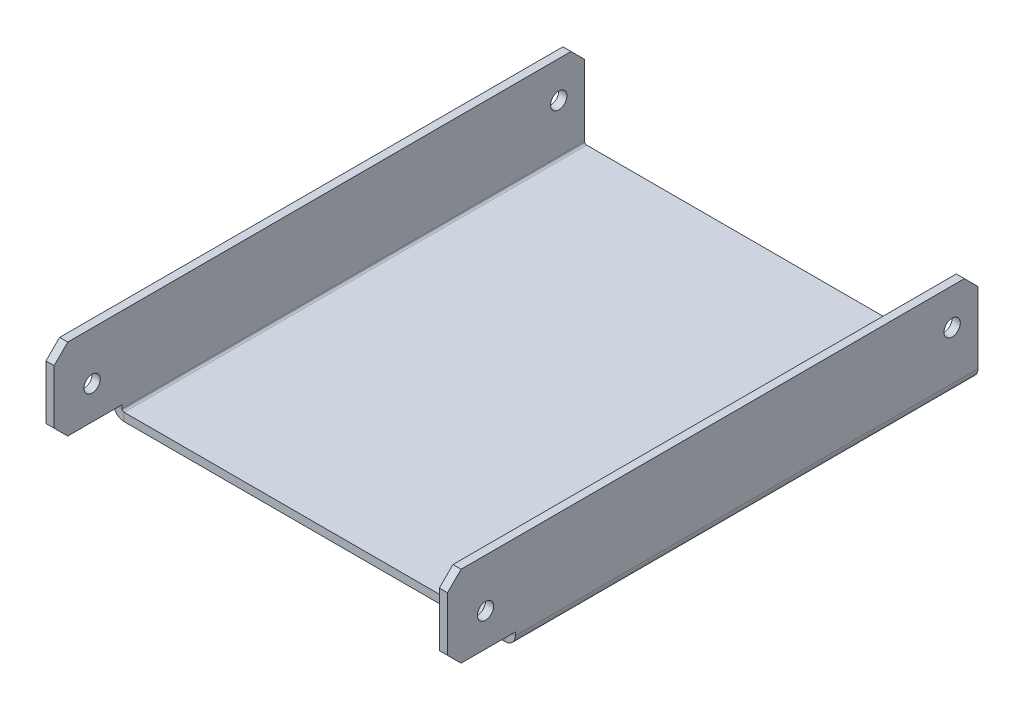
from build123d import *

# Parameters (mm, degrees)
SKETCH18_W                     = 148
SKETCH18_H                     = 205.5334
BASE_FLANGE1_DEPTH             = 3
EDGE_FLANGE1_STRIP_W           = 13.4732
EDGE_FLANGE1_STRIP_H           = 3
EDGE_FLANGE1_STRIP_CUT_DEPTH   = 205.5334
EDGE_FLANGE1_STRIP_2_W         = 13.4732
EDGE_FLANGE1_STRIP_2_H         = 3
EDGE_FLANGE1_STRIP_CUT_2_DEPTH = 205.5334
EDGE_FLANGE1_DEPTH             = 205.5334
EDGE_FLANGE1_BEND_DEPTH        = 205.5334
SKETCH28_W                     = 150
SKETCH28_H                     = 8
CUT_EXTRUDE2_DEPTH             = 25
SKETCH30_R                     = 3
CUT_EXTRUDE3_DEPTH             = 225.935458149
SKETCH31_W                     = 157.455262849
SKETCH31_H                     = 40
CUT_EXTRUDE4_DEPTH             = 10
CHAMFER1_SIZE                  = 5


# Sheet-metal steps are written as plain solids
with BuildPart() as part:
    # Sketch18 → Base-Flange1 (new body)
    with BuildSketch(Plane(origin=(0, 0, 0), x_dir=(1, 0, 0), z_dir=(0, 1, 0))):
        with Locations((-74, -63.57018807)):
            Rectangle(SKETCH18_W, SKETCH18_H)
    extrude(amount=-BASE_FLANGE1_DEPTH)

    # Edge-Flange1 strip (across the edge) → Edge-Flange1 strip cut (cut)
    with BuildSketch(Plane(origin=(0, 0, 166.33688807), x_dir=(-1, 0, 0), z_dir=(0, 0, -1))):
        with Locations((-3, -1.5)):
            Rectangle(EDGE_FLANGE1_STRIP_W, EDGE_FLANGE1_STRIP_H)
    extrude(amount=EDGE_FLANGE1_STRIP_CUT_DEPTH, mode=Mode.SUBTRACT)

    # Edge-Flange1 strip 2 (across the edge) → Edge-Flange1 strip cut 2 (cut)
    with BuildSketch(Plane(origin=(-148, 0, -39.19651193), x_dir=(1, 0, 0), z_dir=(0, 0, 1))):
        with Locations((-3, -1.5)):
            Rectangle(EDGE_FLANGE1_STRIP_2_W, EDGE_FLANGE1_STRIP_2_H)
    extrude(amount=EDGE_FLANGE1_STRIP_CUT_2_DEPTH, mode=Mode.SUBTRACT)

    # Edge-Flange1 section (across the edge) → Edge-Flange1 (add)
    with BuildSketch(Plane(origin=(0, 0, 166.33688807), x_dir=(-1, 0, 0), z_dir=(0, 0, -1))):
        with BuildLine():
            Line((0, 0.7366), (0, 32))
            Line((0, 32), (3, 32))
            Line((3, 32), (3, 0.7366))
            ThreePointArc((3, 0.7366), (3.215745145, 0.215745145), (3.7366, 0))
            Line((3.7366, 0), (3.7366, -3))
            ThreePointArc((3.7366, -3), (1.094424801, -1.905575199), (0, 0.7366))
        make_face()
    extrude(amount=EDGE_FLANGE1_DEPTH)

    # Edge-Flange1 section 2 (across the edge) → Edge-Flange1 bend (add)
    with BuildSketch(Plane(origin=(-148, 0, -39.19651193), x_dir=(1, 0, 0), z_dir=(0, 0, 1))):
        with BuildLine():
            Line((0, 0.7366), (0, 32))
            Line((0, 32), (3, 32))
            Line((3, 32), (3, 0.7366))
            ThreePointArc((3, 0.7366), (3.215745145, 0.215745145), (3.7366, 0))
            Line((3.7366, 0), (3.7366, -3))
            ThreePointArc((3.7366, -3), (1.094424801, -1.905575199), (0, 0.7366))
        make_face()
    extrude(amount=EDGE_FLANGE1_BEND_DEPTH)

    # Sketch28 → Cut-Extrude2 (cut)
    with BuildSketch(Plane.XY.offset(166.33688807)):
        with Locations((-74, -2)):
            Rectangle(SKETCH28_W, SKETCH28_H)
    extrude(amount=-CUT_EXTRUDE2_DEPTH, mode=Mode.SUBTRACT)

    # Sketch30 → Cut-Extrude3 (cut, through all)
    with BuildSketch(Plane.ZY.offset(148)):
        with Locations(Location((152.33688807, 14.23, 0), (0, 0, 270))):
            Circle(SKETCH30_R)
        with Locations(Location((-19.66651193, 18.64, 0), (0, 0, 270))):
            Circle(SKETCH30_R)
    extrude(amount=-CUT_EXTRUDE3_DEPTH, mode=Mode.SUBTRACT)

    # Sketch31 → Cut-Extrude4 (cut)
    with BuildSketch(Plane(origin=(0, 0, -39.19651193), x_dir=(-1, 0, 0), z_dir=(0, 0, -1))):
        with Locations((75.148815223, 17)):
            Rectangle(SKETCH31_W, SKETCH31_H)
    extrude(amount=-CUT_EXTRUDE4_DEPTH, mode=Mode.SUBTRACT)

    # Chamfer1
    chamfer1_edges = [part.edges().sort_by_distance(p)[0] for p in [
        (-1.5, 2, 166.33688807),
        (-146.5, 32, -29.19651193),
        (-1.5, 32, -29.19651193),
        (-1.5, 32, 166.33688807),
        (-146.5, 32, 166.33688807),
        (-146.5, 2, 166.33688807),
    ]]
    chamfer(chamfer1_edges, length=CHAMFER1_SIZE)


solid = part.part
